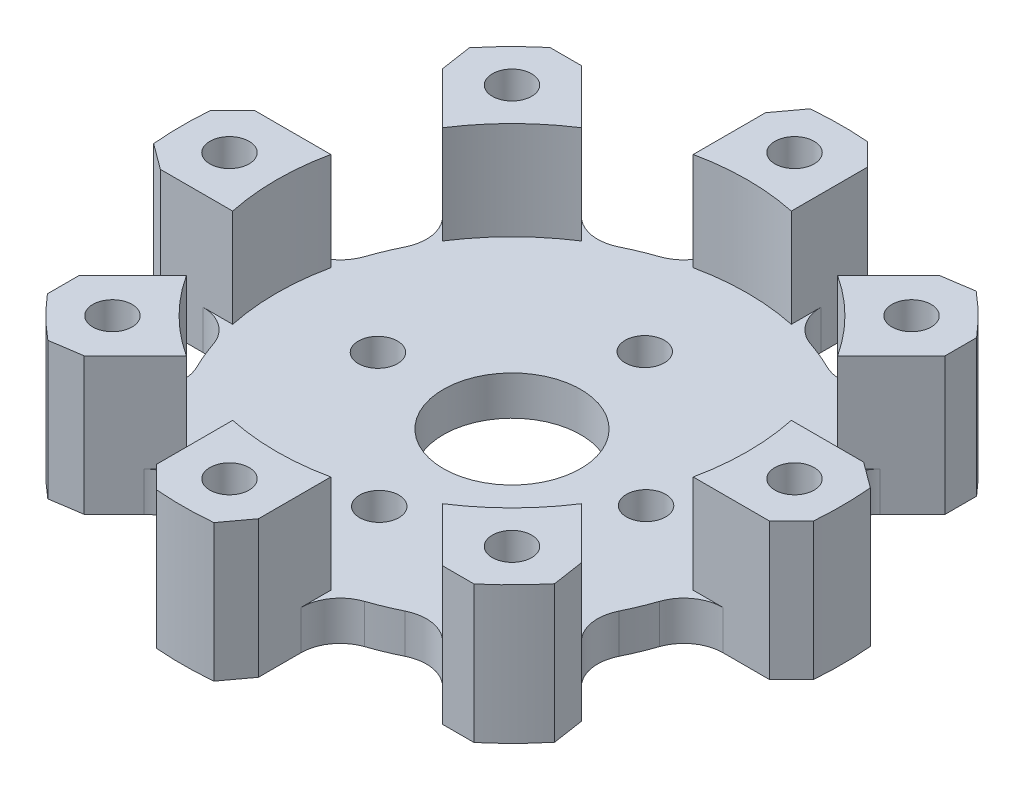
from build123d import *

# Parameters (mm, degrees)
SKETCH1_R                                       = 38.1
BASE_EXTRUDE_DEPTH                              = 6.35
COLUMN_DEPTH                                    = 22.225
SKETCH3_R                                       = 3.175
FASTENER_HOLE_CUT_1_DEPTH                       = 70.215
RELIEF_FILLETS_R                                = 6.35
COSMETIC_CHAMFER_SIZE                           = 3.175
COSMETIC_CHAMFER_SIZE_2                         = 3.779508342
COLUMN_AND_HOLE_PATTERN_COUNT                   = 8
RELIEF_FILLETS_OF_COLUMN_AND_HOLE_PATTER_R      = 6.35
COSMETIC_CHAMFER_OF_COLUMN_AND_HOLE_PATT_SIZE   = 3.175
COSMETIC_CHAMFER_OF_COLUMN_AND_HOLE_PATT_SIZE_2 = 3.779508342
SKETCH4_R                                       = 11.1125
BEARING_HOLE_CUT_DEPTH                          = 79.640077728
SKETCH5_R                                       = 3.175
FASTENER_HOLE_CUT_2_DEPTH                       = 79.640077728
FASTENER_HOLE_CUT_2_PATTERN_COUNT               = 4
HEXAGONAL_COUNTERBORE_DEPTH                     = 10.668
HEXAGONAL_COUNTERBORE_PATTERN_COUNT             = 8


with BuildPart() as part:
    # Sketch1 → Base Extrude (new body)
    with BuildSketch(Plane(origin=(0, 0, 0), x_dir=(1, 0, 0), z_dir=(0, 1, 0))):
        with Locations(Location((0, 0, 0), (0, 0, 270))):
            Circle(SKETCH1_R)
    extrude(amount=BASE_EXTRUDE_DEPTH)

    # Sketch2 → Column (add)
    with BuildSketch(Plane(origin=(0, 0, 0), x_dir=(1, 0, 0), z_dir=(0, 1, 0))):
        with BuildLine():
            Line((-7.9375, 37.264005337), (-7.9375, 52.746105958))
            ThreePointArc((-7.9375, 52.746105958), (0, 53.34), (7.9375, 52.746105958))
            Line((7.9375, 52.746105958), (7.9375, 37.264005337))
            ThreePointArc((7.9375, 37.264005337), (0, 38.1), (-7.9375, 37.264005337))
        make_face()
    column = extrude(amount=COLUMN_DEPTH)

    # Sketch3 → Fastener Hole Cut 1 (cut, through all)
    with BuildSketch(Plane(origin=(0, 0, 0), x_dir=(1, 0, 0), z_dir=(0, 1, 0))):
        with Locations(Location((0, 45.72, 0), (0, 0, 270))):
            Circle(SKETCH3_R)
    fastener_hole_cut_1 = extrude(amount=FASTENER_HOLE_CUT_1_DEPTH, mode=Mode.SUBTRACT)

    # Relief Fillets
    relief_fillets_edges = [part.edges().sort_by_distance(p)[0] for p in [
        (-7.9375, 3.175, -37.264005337),
        (7.9375, 3.175, -37.264005337),
    ]]
    fillet(relief_fillets_edges, radius=RELIEF_FILLETS_R)

    # Cosmetic Chamfer
    # the kernel refuses this chamfer: 3.779508342, 3.175 mm, written as the material it takes off along each edge
    with BuildSketch(Plane(origin=(7.9375, -9.338283517, -52.746105958), x_dir=(0, 0, 1), z_dir=(0, 1, 0))) as cosmetic_chamfer_piece_1:
        with BuildLine():
            Line((COSMETIC_CHAMFER_SIZE, 0), (-0.416553381, -3.591553381))
            ThreePointArc((-0.416553381, -3.591553381), (-0.245508575, -1.851089796), (0, 0))
            Line((0, 0), (COSMETIC_CHAMFER_SIZE, 0))
        make_face()
    extrude(amount=40.901567034, mode=Mode.SUBTRACT)
    with BuildSketch(Plane(origin=(-7.9375, -9.75540011, -52.746105958), x_dir=(0.9927578423124379, 0, -0.12013270382020418), z_dir=(0, 1, 0))) as cosmetic_chamfer_piece_2:
        with BuildLine():
            Line((3.086966097, 0), (-COSMETIC_CHAMFER_SIZE_2 * 0.120132703811, -COSMETIC_CHAMFER_SIZE_2 * 0.99275784224))
            Line((-COSMETIC_CHAMFER_SIZE_2 * 0.120132703811, -COSMETIC_CHAMFER_SIZE_2 * 0.99275784224), (0, 0))
            ThreePointArc((0, 0), (1.59533256, 0.022311122), (3.086966097, 0))
        make_face()
    extrude(amount=41.735800221, mode=Mode.SUBTRACT)

    # Column and Hole Pattern: Column, Fastener Hole Cut 1 ×8 about axis
    column_and_hole_pattern_axis = Axis((0, 0, 0), (0, 1, 0))
    add([column.rotate(column_and_hole_pattern_axis, i * 360 / COLUMN_AND_HOLE_PATTERN_COUNT) for i in range(1, COLUMN_AND_HOLE_PATTERN_COUNT)])
    add([fastener_hole_cut_1.rotate(column_and_hole_pattern_axis, i * 360 / COLUMN_AND_HOLE_PATTERN_COUNT) for i in range(1, COLUMN_AND_HOLE_PATTERN_COUNT)], mode=Mode.SUBTRACT)

    # Relief Fillets of Column and Hole Patter
    relief_fillets_of_column_and_hole_patter_edges = [part.edges().sort_by_distance(p)[0] for p in [
        (-31.962290944, 3.175, -20.736970792),
        (-20.736970792, 3.175, -31.962290944),
        (-37.264005337, 3.175, 7.9375),
        (-37.264005337, 3.175, -7.9375),
        (-20.736970792, 3.175, 31.962290944),
        (-31.962290944, 3.175, 20.736970792),
        (7.9375, 3.175, 37.264005337),
        (-7.9375, 3.175, 37.264005337),
        (31.962290944, 3.175, 20.736970792),
        (20.736970792, 3.175, 31.962290944),
        (37.264005337, 3.175, -7.9375),
        (37.264005337, 3.175, 7.9375),
        (20.736970792, 3.175, -31.962290944),
        (31.962290944, 3.175, -20.736970792),
    ]]
    fillet(relief_fillets_of_column_and_hole_patter_edges, radius=RELIEF_FILLETS_OF_COLUMN_AND_HOLE_PATTER_R)

    # Cosmetic Chamfer of Column and Hole Patt
    # the kernel refuses this chamfer: 3.779508342, 3.175 mm, written as the material it takes off along each edge
    with BuildSketch(Plane(origin=(-31.684469129, -9.338283517, -42.90978928), x_dir=(0.7071067811865481, 0, 0.707106781186547), z_dir=(0, 1, 0)), Plane(origin=(-52.746105958, -9.338283517, -7.9375), x_dir=(1, 0, 0), z_dir=(0, 1, 0)), Plane(origin=(-42.90978928, -9.338283517, 31.684469129), x_dir=(0.707106781186547, 0, -0.7071067811865481), z_dir=(0, 1, 0))) as cosmetic_chamfer_of_column_and_hole_patt_piece_1:
        with BuildLine():
            Line((COSMETIC_CHAMFER_OF_COLUMN_AND_HOLE_PATT_SIZE, 0), (-0.416553381, -3.591553381))
            ThreePointArc((-0.416553381, -3.591553381), (-0.245508575, -1.851089796), (0, 0))
            Line((0, 0), (COSMETIC_CHAMFER_OF_COLUMN_AND_HOLE_PATT_SIZE, 0))
        make_face()
    extrude(amount=40.901567034, mode=Mode.SUBTRACT)
    with BuildSketch(Plane(origin=(-42.90978928, -9.75540011, -31.684469129), x_dir=(0.6170391528617049, 0, -0.7869324518887945), z_dir=(0, 1, 0)), Plane(origin=(-52.746105958, -9.75540011, 7.9375), x_dir=(-0.12013270382020418, 0, -0.9927578423124379), z_dir=(0, 1, 0)), Plane(origin=(-31.684469129, -9.75540011, 42.90978928), x_dir=(-0.7869324518887931, 0, -0.6170391528617065), z_dir=(0, 1, 0))) as cosmetic_chamfer_of_column_and_hole_patt_piece_2:
        with BuildLine():
            Line((3.086966097, 0), (-COSMETIC_CHAMFER_OF_COLUMN_AND_HOLE_PATT_SIZE_2 * 0.120132703812, -COSMETIC_CHAMFER_OF_COLUMN_AND_HOLE_PATT_SIZE_2 * 0.99275784224))
            Line((-COSMETIC_CHAMFER_OF_COLUMN_AND_HOLE_PATT_SIZE_2 * 0.120132703812, -COSMETIC_CHAMFER_OF_COLUMN_AND_HOLE_PATT_SIZE_2 * 0.99275784224), (0, 0))
            ThreePointArc((0, 0), (1.59533256, 0.022311122), (3.086966097, 0))
        make_face()
    extrude(amount=41.735800221, mode=Mode.SUBTRACT)
    with BuildSketch(Plane(origin=(-7.9375, -9.338283517, 52.746105958), x_dir=(0.9933412613393435, 0, 0.11520910780299456), z_dir=(0, 1, 0)), Plane(origin=(31.684469129, -9.338283517, 42.90978928), x_dir=(0.7838634833074002, 0, -0.6209332005434958), z_dir=(0, 1, 0)), Plane(origin=(52.746105958, -9.338283517, 7.9375), x_dir=(0.11520910780299634, 0, -0.9933412613393433), z_dir=(0, 1, 0)), Plane(origin=(42.90978928, -9.338283517, -31.684469129), x_dir=(-0.620933200543497, 0, -0.7838634833073992), z_dir=(0, 1, 0))) as cosmetic_chamfer_of_column_and_hole_patt_piece_3:
        with BuildLine():
            Line((3.615628909, 0), (-COSMETIC_CHAMFER_OF_COLUMN_AND_HOLE_PATT_SIZE * 0.115209107803, COSMETIC_CHAMFER_OF_COLUMN_AND_HOLE_PATT_SIZE * 0.993341261339))
            Line((-COSMETIC_CHAMFER_OF_COLUMN_AND_HOLE_PATT_SIZE * 0.115209107803, COSMETIC_CHAMFER_OF_COLUMN_AND_HOLE_PATT_SIZE * 0.993341261339), (0, 0))
            ThreePointArc((0, 0), (1.867048697, -0.030611394), (3.615628909, 0))
        make_face()
    extrude(amount=40.901567034, mode=Mode.SUBTRACT)
    with BuildSketch(Plane(origin=(7.9375, -9.75540011, 52.746105958), x_dir=(0, 0, -1), z_dir=(0, 1, 0)), Plane(origin=(42.90978928, -9.75540011, 31.684469129), x_dir=(-0.7071067811865475, 0, -0.7071067811865475), z_dir=(0, 1, 0)), Plane(origin=(52.746105958, -9.75540011, -7.9375), x_dir=(-1, 0, 0), z_dir=(0, 1, 0)), Plane(origin=(31.684469129, -9.75540011, -42.90978928), x_dir=(-0.707106781186548, 0, 0.707106781186547), z_dir=(0, 1, 0))) as cosmetic_chamfer_of_column_and_hole_patt_piece_4:
        with BuildLine():
            Line((COSMETIC_CHAMFER_OF_COLUMN_AND_HOLE_PATT_SIZE_2, 0), (-0.370845584, 3.064609802))
            ThreePointArc((-0.370845584, 3.064609802), (-0.213801155, 1.581098614), (0, 0))
            Line((0, 0), (COSMETIC_CHAMFER_OF_COLUMN_AND_HOLE_PATT_SIZE_2, 0))
        make_face()
    extrude(amount=41.735800221, mode=Mode.SUBTRACT)

    # Sketch4 → Bearing Hole Cut (cut, through all)
    with BuildSketch(Plane(origin=(0, 0, 0), x_dir=(1, 0, 0), z_dir=(0, 1, 0))):
        with Locations(Location((0, 0, 0), (0, 0, 270))):
            Circle(SKETCH4_R)
    extrude(amount=BEARING_HOLE_CUT_DEPTH, mode=Mode.SUBTRACT)

    # Sketch5 → Fastener Hole Cut 2 (cut, through all)
    with BuildSketch(Plane(origin=(0, 0, 0), x_dir=(1, 0, 0), z_dir=(0, 1, 0))):
        with Locations(Location((-0.107043787, 21.589734635, 0), (0, 0, 270))):
            Circle(SKETCH5_R)
    fastener_hole_cut_2 = extrude(amount=FASTENER_HOLE_CUT_2_DEPTH, mode=Mode.SUBTRACT)

    # Fastener Hole Cut 2 Pattern: Fastener Hole Cut 2 ×4 about axis
    fastener_hole_cut_2_pattern_axis = Axis((0, 0, 0), (0, 1, 0))
    for i in range(1, FASTENER_HOLE_CUT_2_PATTERN_COUNT):
        add(fastener_hole_cut_2.rotate(fastener_hole_cut_2_pattern_axis, i * 360 / FASTENER_HOLE_CUT_2_PATTERN_COUNT), mode=Mode.SUBTRACT)

    # Sketch6 → Hexagonal Counterbore (cut)
    with BuildSketch(Plane(origin=(0, 0, 0), x_dir=(1, 0, 0), z_dir=(0, 1, 0))):
        Polygon((6.415804866, 45.72), (3.207902433, 51.27625), (-3.207902433, 51.27625), (-6.415804866, 45.72), (-3.207902433, 40.16375), (3.207902433, 40.16375), align=None)
    hexagonal_counterbore = extrude(amount=HEXAGONAL_COUNTERBORE_DEPTH, mode=Mode.SUBTRACT)

    # Hexagonal Counterbore Pattern: Hexagonal Counterbore ×8 about axis
    hexagonal_counterbore_pattern_axis = Axis((0, 0, 0), (0, 1, 0))
    for i in range(1, HEXAGONAL_COUNTERBORE_PATTERN_COUNT):
        add(hexagonal_counterbore.rotate(hexagonal_counterbore_pattern_axis, i * 360 / HEXAGONAL_COUNTERBORE_PATTERN_COUNT), mode=Mode.SUBTRACT)


solid = part.part
